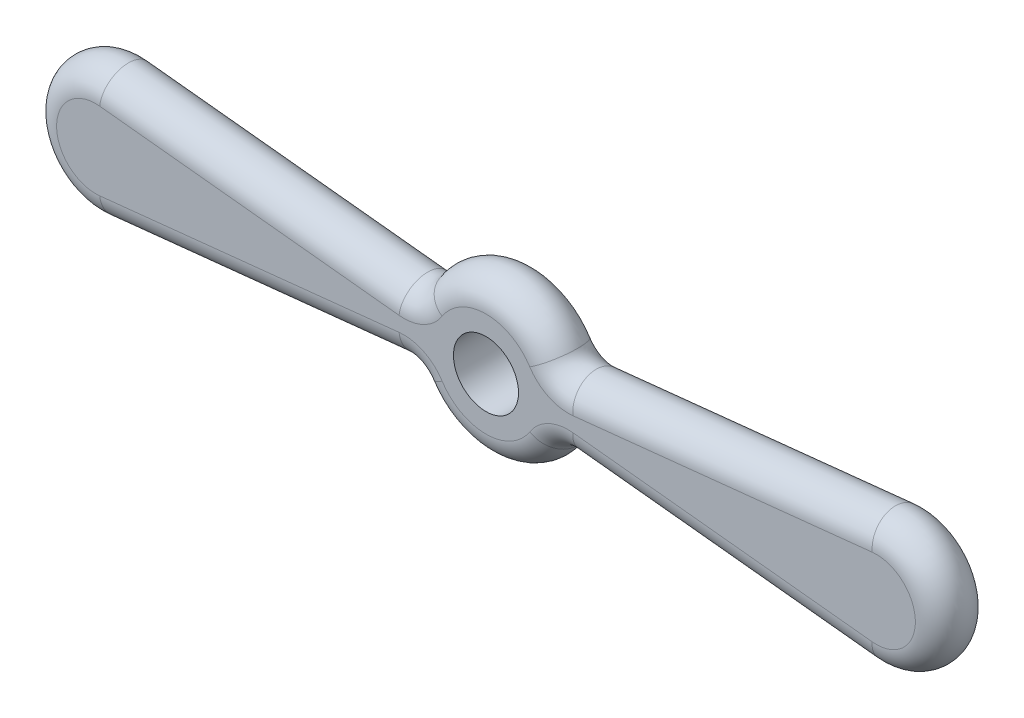
from build123d import *

# Parameters (mm, degrees)
SKETCH1_R           = 5
BOSS_EXTRUDE1_DEPTH = 8
FILLET1_R           = 4


with BuildPart() as part:
    # Sketch1 → Boss-Extrude1 (new body)
    with BuildSketch(Plane.XY):
        with BuildLine():
            Line((12.943190902, 5.109212861), (58.954715367, 9.945218954))
            ThreePointArc((58.954715367, 9.945218954), (70, 0), (58.954715367, -9.945218954))
            Line((58.954715367, -9.945218954), (12.943190902, -5.109212861))
            ThreePointArc((12.943190902, -5.109212861), (11.32982846, -5.388970193), (10.103684409, -6.474222838))
            ThreePointArc((10.103684409, -6.474222838), (0, -12), (-10.103684409, -6.474222838))
            ThreePointArc((-10.103684409, -6.474222838), (-11.32982846, -5.388970193), (-12.943190902, -5.109212861))
            Line((-12.943190902, -5.109212861), (-58.954715367, -9.945218954))
            ThreePointArc((-58.954715367, -9.945218954), (-70, 0), (-58.954715367, 9.945218954))
            Line((-58.954715367, 9.945218954), (-12.943190902, 5.109212861))
            ThreePointArc((-12.943190902, 5.109212861), (-11.32982846, 5.388970193), (-10.103684409, 6.474222838))
            ThreePointArc((-10.103684409, 6.474222838), (0, 12), (10.103684409, 6.474222838))
            ThreePointArc((10.103684409, 6.474222838), (11.32982846, 5.388970193), (12.943190902, 5.109212861))
        make_face()
        Circle(SKETCH1_R, mode=Mode.SUBTRACT)
    extrude(amount=BOSS_EXTRUDE1_DEPTH)

    # Fillet1
    fillet1_edges = [part.edges().sort_by_distance(p)[0] for p in [
        (0, 12, 0),
        (-11.32982846, -5.388970193, 0),
        (70, 0, 8),
        (-35.948953134, -7.527215907, 0),
        (-70, 0, 0),
        (-35.948953134, 7.527215907, 0),
        (-11.32982846, 5.388970193, 0),
        (11.32982846, 5.388970193, 0),
        (35.948953134, 7.527215907, 0),
        (35.948953134, -7.527215907, 0),
        (11.32982846, -5.388970193, 0),
        (35.948953134, 7.527215907, 8),
        (-35.948953134, 7.527215907, 8),
        (-35.948953134, -7.527215907, 8),
        (35.948953134, -7.527215907, 8),
    ]]
    fillet(fillet1_edges, radius=FILLET1_R - 0.0001)  # a hair under: the kernel refuses the full size


solid = part.part
